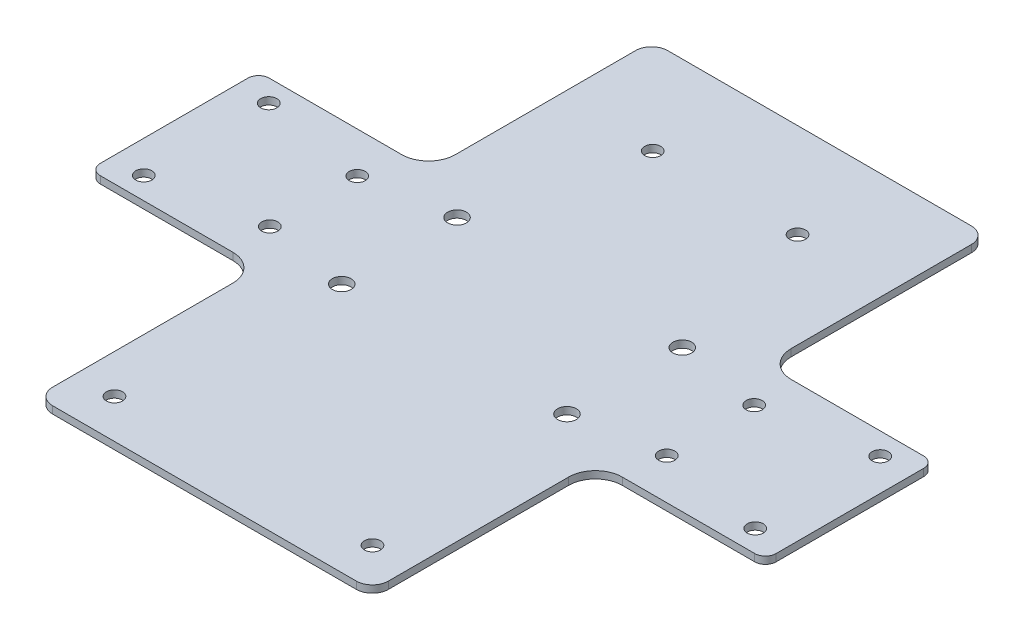
from build123d import *

# Parameters (mm, degrees)
SKETCH3_R           = 1.5
BOSS_EXTRUDE1_DEPTH = 1.35
FILLET1_R           = 2
FILLET2_R           = 3
FILLET3_R           = 5
SKETCH4_R           = 1.75
CUT_EXTRUDE1_DEPTH  = 86.197993521


with BuildPart() as part:
    # Sketch3 → Boss-Extrude1 (new body)
    with BuildSketch(Plane(origin=(0, 0, 0), x_dir=(1, 0, 0), z_dir=(0, 1, 0))):
        Polygon((31.305, 15.75), (31.305, 57.34), (-31.305, 57.34), (-31.305, 15.75), (-63, 15.75), (-63, -15.75), (-31.305, -15.75), (-31.305, -57.34), (31.305, -57.34), (31.305, -15.75), (63, -15.75), (63, 15.75), align=None)
        with Locations((-57, 11.65)):
            Circle(SKETCH3_R, mode=Mode.SUBTRACT)
        with Locations((-57, -11.65)):
            Circle(SKETCH3_R, mode=Mode.SUBTRACT)
        with Locations((-37, -8.15)):
            Circle(SKETCH3_R, mode=Mode.SUBTRACT)
        with Locations((-37, 8.15)):
            Circle(SKETCH3_R, mode=Mode.SUBTRACT)
        with Locations((37, 8.15)):
            Circle(SKETCH3_R, mode=Mode.SUBTRACT)
        with Locations((57, 11.65)):
            Circle(SKETCH3_R, mode=Mode.SUBTRACT)
        with Locations((57, -11.65)):
            Circle(SKETCH3_R, mode=Mode.SUBTRACT)
        with Locations((37, -8.15)):
            Circle(SKETCH3_R, mode=Mode.SUBTRACT)
        with Locations((-13.5, 39.735100189)):
            Circle(SKETCH3_R, mode=Mode.SUBTRACT)
        with Locations((13.5, 39.735100189)):
            Circle(SKETCH3_R, mode=Mode.SUBTRACT)
        with Locations((-24.05, -50.064899811)):
            Circle(SKETCH3_R, mode=Mode.SUBTRACT)
        with Locations((24.05, -50.064899811)):
            Circle(SKETCH3_R, mode=Mode.SUBTRACT)
    extrude(amount=BOSS_EXTRUDE1_DEPTH)

    # Fillet1
    fillet1_edges = [part.edges().sort_by_distance(p)[0] for p in [
        (-63, 0.675, -15.75),
        (63, 0.675, -15.75),
        (63, 0.675, 15.75),
        (-63, 0.675, 15.75),
    ]]
    fillet(fillet1_edges, radius=FILLET1_R)

    # Fillet2
    fillet2_edges = [part.edges().sort_by_distance(p)[0] for p in [
        (-31.305, 0.675, -57.34),
        (31.305, 0.675, -57.34),
        (31.305, 0.675, 57.34),
        (-31.305, 0.675, 57.34),
    ]]
    fillet(fillet2_edges, radius=FILLET2_R)

    # Fillet3
    fillet3_edges = [part.edges().sort_by_distance(p)[0] for p in [
        (-31.305, 0.675, -15.75),
        (-31.305, 0.675, 15.75),
        (31.305, 0.675, -15.75),
        (31.305, 0.675, 15.75),
    ]]
    fillet(fillet3_edges, radius=FILLET3_R)

    # Sketch4 → Cut-Extrude1 (cut, through all)
    with BuildSketch(Plane(origin=(0, 1.35, 0), x_dir=(1, 0, 0), z_dir=(0, 1, 0))):
        with Locations((-21, -10.75)):
            Circle(SKETCH4_R)
        with Locations((21, -10.75)):
            Circle(SKETCH4_R)
        with Locations((21, 10.75)):
            Circle(SKETCH4_R)
        with Locations((-21, 10.75)):
            Circle(SKETCH4_R)
    extrude(amount=-CUT_EXTRUDE1_DEPTH, mode=Mode.SUBTRACT)


solid = part.part
